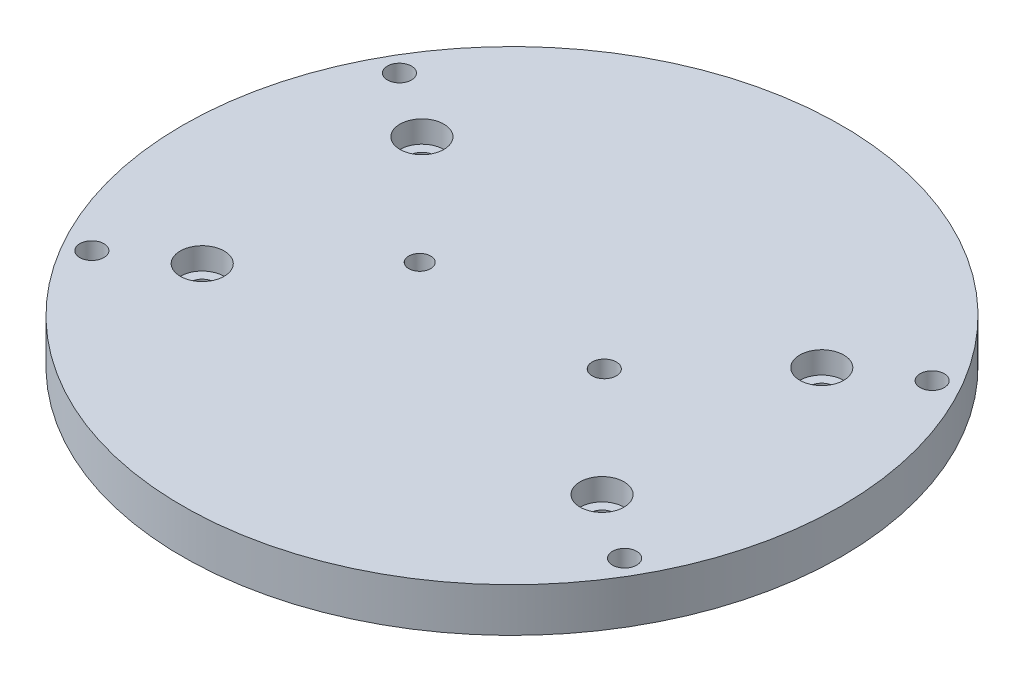
from build123d import *

# Parameters (mm, degrees)
SKETCH_1_R                   = 11
EXTRUDE_567_DEPTH            = 100
EXTRUDE_START                = -100
SKETCH_2_R                   = 11
EXTRUDE_876_DEPTH            = 100
EXTRUDE_2692_DEPTH           = 100
CUT_EXTRUDE_4149_DEPTH       = 534.010318849
CUT_EXTRUDE_4149_DEPTH_BACK  = 534.010318849
SKETCH_3_W                   = 90
SKETCH_3_H                   = 380
SKETCH_5_R                   = 2.5
EXTRUDE_4715_DEPTH           = 100
SKETCH_6_W                   = 191.177045066
SKETCH_6_H                   = 235.084722287
CUT_EXTRUDE_5029_DEPTH       = 84
SKETCH_7_R                   = 75
EXTRUDE_5317_DEPTH           = 10
CUT_EXTRUDE_6099_DEPTH       = 361.763080151
CUT_EXTRUDE_6099_DEPTH_BACK  = 361.763080151
FILLET_2_R                   = 2
MIRROR_START                 = 95
MIRROR_1_DEPTH               = 5
CUT_EXTRUDE_11152_DEPTH      = 361.763080151
CUT_EXTRUDE_11152_DEPTH_BACK = 361.763080151
SKETCH_12_W                  = 10
SKETCH_12_H                  = 20
FILLET_3_R                   = 1
CUT_EXTRUDE_START            = -5
CUT_EXTRUDE_12033_OUTLINE_R  = 5
CUT_EXTRUDE_12033_DEPTH      = 5
CUT_EXTRUDE_7_DEPTH          = 361.763080151
CUT_EXTRUDE_7_DEPTH_BACK     = 361.763080151
SKETCH_14_W                  = 10
SKETCH_14_H                  = 20
FILLET_4_R                   = 1
CUT_EXTRUDE_START_2          = -129
SKETCH_15_R                  = 11
CUT_EXTRUDE_8_DEPTH          = 129
SKETCH_16_R                  = 13
CUT_EXTRUDE_9_DEPTH          = 0.75
CUT_EXTRUDE_START_3          = -0.75
SKETCH_17_R                  = 13
CUT_EXTRUDE_10_DEPTH         = 0.75
SKETCH_18_R                  = 9.5
CUT_EXTRUDE_11_DEPTH         = 113
CUT_EXTRUDE_12_DEPTH         = 361.763080151
CUT_EXTRUDE_12_DEPTH_BACK    = 361.763080151
CUT_EXTRUDE_13_DEPTH         = 147.116391962
CUT_EXTRUDE_13_DEPTH_BACK    = 147.116391962
SKETCH_22_R                  = 2.75
SKETCH_22_R_2                = 2.5
SKETCH_26_R                  = 5
CUT_EXTRUDE_15_DEPTH         = 5


# Read off the part's stored shape, not the designer's step: 镜向1, 电机安装轴承孔
with BuildPart() as part:
    # 草图1 → Extrude 567 (new body)
    with BuildSketch(Plane.XY):
        with BuildLine():
            Line((-18, 500), (-18, 0))
            ThreePointArc((-18, 0), (0, -18), (18, 0))
            Line((18, 0), (18, 500))
            ThreePointArc((18, 500), (0, 518), (-18, 500))
        make_face()
        with Locations((0, 500)):
            Circle(SKETCH_1_R, mode=Mode.SUBTRACT)
        Circle(SKETCH_1_R, mode=Mode.SUBTRACT)
    extrude(amount=EXTRUDE_567_DEPTH)

    # 草图2 → Extrude 876 (add)
    with BuildSketch(Plane.XY.offset(100).offset(EXTRUDE_START)):
        with BuildLine():
            Line((18, 61.301270189), (25, 61.301270189))
            ThreePointArc((25, 61.301270189), (40.588457268, 52.301270189), (40.588457268, 34.301270189))
            Line((40.588457268, 34.301270189), (15.588457268, -9))
            ThreePointArc((15.588457268, -9), (-4.658742812, -17.386664873), (-18, 0))
            Line((-18, 0), (-18, 61.301270189))
            Line((-18, 61.301270189), (18, 61.301270189))
        make_face()
        with Locations((25, 43.301270189)):
            Circle(SKETCH_2_R, mode=Mode.SUBTRACT)
        Circle(SKETCH_2_R, mode=Mode.SUBTRACT)
    extrude(amount=EXTRUDE_876_DEPTH)

    # 草图10 → Extrude 2692 (add)
    with BuildSketch(Plane(origin=(0, 0, 0), x_dir=(-1, 0, 0), z_dir=(0, 0, -1))):
        with BuildLine():
            Line((-41.914467174, 37.144907609), (-58, 81.339545828))
            Line((-58, 81.339545828), (-58, 320))
            Line((-58, 320), (-18, 320))
            Line((-18, 320), (-18, 61.301270189))
            Line((-18, 61.301270189), (-25, 61.301270189))
            ThreePointArc((-25, 61.301270189), (-39.744736797, 53.625646044), (-41.914467174, 37.144907609))
        make_face()
        with BuildLine():
            Line((12.727922061, -12.727922061), (58, 32.544155877))
            Line((58, 32.544155877), (58, 320))
            Line((58, 320), (18, 320))
            Line((18, 320), (18, 0))
            ThreePointArc((18, 0), (16.629831585, -6.888301783), (12.727922061, -12.727922061))
        make_face()
    extrude(amount=-EXTRUDE_2692_DEPTH)

    # 草图3 → Cut-Extrude 4149 (cut, two sides: drawn at the far end of the back side and taken through both)
    with BuildSketch(Plane.ZY.offset(18).offset(-CUT_EXTRUDE_4149_DEPTH_BACK)):
        with Locations((50, 150)):
            Rectangle(SKETCH_3_W, SKETCH_3_H)
    extrude(amount=CUT_EXTRUDE_4149_DEPTH + CUT_EXTRUDE_4149_DEPTH_BACK, mode=Mode.SUBTRACT)

    # 草图5 → Extrude 4715 (add)
    with BuildSketch(Plane.XY.offset(100)):
        with Locations(Location((0, 250, 0), (0, 0, 90))):
            Circle(SKETCH_5_R)
    extrude(amount=-EXTRUDE_4715_DEPTH)

    # 草图6 → Cut-Extrude 5029 (cut)
    with BuildSketch(Plane(origin=(18, 0, 0), x_dir=(0, 0, -1), z_dir=(1, 0, 0))):
        with Locations((-50.962374235, 437.542361144)):
            Rectangle(SKETCH_6_W, SKETCH_6_H)
    extrude(amount=-CUT_EXTRUDE_5029_DEPTH, mode=Mode.SUBTRACT)

    # 草图7 → Extrude 5317 (add)
    with BuildSketch(Plane(origin=(0, 320, 0), x_dir=(1, 0, 0), z_dir=(0, 1, 0))):
        with Locations(Location((0, -50, 0), (0, 0, 320.654170234))):
            Circle(SKETCH_7_R)
    extrude(amount=EXTRUDE_5317_DEPTH)

    # 草图10<3> → Cut-Extrude 6099 (cut, two sides: drawn at the far end of the back side and taken through both)
    with BuildSketch(Plane(origin=(0, 0, 0), x_dir=(-1, 0, 0), z_dir=(0, 0, -1)).offset(-CUT_EXTRUDE_6099_DEPTH_BACK)):
        Polygon((50, 310), (18, 310), (18, 278), align=None)
        Polygon((-18, 278), (-18, 310), (-50, 310), align=None)
        Polygon((-18, 227.925713543), (-18, 259.925713543), (-50, 259.925713543), align=None)
        Polygon((50, 259.925713543), (18, 259.925713543), (18, 227.925713543), align=None)
        Polygon((50, 248.612005044), (50, 216.612005044), (18, 216.612005044), align=None)
        Polygon((-50, 248.612005044), (-50, 216.612005044), (-18, 216.612005044), align=None)
        Polygon((-18, 177.851427085), (-18, 209.851427085), (-50, 209.851427085), align=None)
        Polygon((50, 209.851427085), (18, 209.851427085), (18, 177.851427085), align=None)
        Polygon((50, 198.537718586), (50, 166.537718586), (18, 166.537718586), align=None)
        Polygon((-50, 198.537718586), (-50, 166.537718586), (-18, 166.537718586), align=None)
        Polygon((-50, 159.777140628), (-18, 127.777140628), (-18, 159.777140628), align=None)
        Polygon((18, 159.777140628), (18, 127.777140628), (50, 159.777140628), align=None)
        Polygon((-50, 109.702854171), (-18, 77.702854171), (-18, 109.702854171), align=None)
        Polygon((18, 109.702854171), (18, 77.702854171), (50, 109.702854171), align=None)
        Polygon((-50, 98.389145672), (-50, 82.750161674), (-44.045077173, 66.389145672), (-18, 66.389145672), align=None)
        Polygon((18, 56.800140588), (18, 24.800140588), (50, 56.800140588), align=None)
        Polygon((50, 95.560718547), (50, 63.560718547), (18, 63.560718547), align=None)
        Polygon((50, 116.463432129), (18, 116.463432129), (50, 148.463432129), align=None)
    extrude(amount=CUT_EXTRUDE_6099_DEPTH + CUT_EXTRUDE_6099_DEPTH_BACK, mode=Mode.SUBTRACT)

    # 圆角2
    fillet_2_edges = [part.edges().sort_by_distance(p)[0] for p in [
        (50, 109.702854171, 2.5),
        (18, 109.702854171, 2.5),
        (18, 77.702854171, 2.5),
        (-18, 159.777140628, 2.5),
        (-50, 159.777140628, 2.5),
        (-18, 127.777140628, 2.5),
        (50, 159.777140628, 2.5),
        (18, 159.777140628, 2.5),
        (18, 127.777140628, 2.5),
        (50, 166.537718586, 2.5),
        (50, 198.537718586, 2.5),
        (18, 166.537718586, 2.5),
        (-50, 63.560718547, 2.5),
        (-18, 63.560718547, 2.5),
        (-50, 95.560718547, 2.5),
        (-50, 56.800140588, 2.5),
        (-18, 24.800140588, 2.5),
        (-18, 56.800140588, 2.5),
        (50, 82.750161674, 2.5),
        (50, 98.389145672, 2.5),
        (18, 66.389145672, 2.5),
        (44.045077173, 66.389145672, 2.5),
        (-18, 109.702854171, 2.5),
        (-50, 109.702854171, 2.5),
        (-18, 77.702854171, 2.5),
        (50, 310, 2.5),
        (18, 310, 2.5),
        (18, 278, 2.5),
        (50, 259.925713543, 2.5),
        (18, 259.925713543, 2.5),
        (18, 227.925713543, 2.5),
        (-50, 248.612005044, 2.5),
        (-50, 216.612005044, 2.5),
        (-18, 216.612005044, 2.5),
        (-18, 259.925713543, 2.5),
        (-50, 259.925713543, 2.5),
        (-18, 227.925713543, 2.5),
        (50, 216.612005044, 2.5),
        (50, 248.612005044, 2.5),
        (18, 216.612005044, 2.5),
        (50, 209.851427085, 2.5),
        (18, 209.851427085, 2.5),
        (18, 177.851427085, 2.5),
        (-50, 198.537718586, 2.5),
        (-50, 166.537718586, 2.5),
        (-18, 166.537718586, 2.5),
        (-18, 209.851427085, 2.5),
        (-50, 209.851427085, 2.5),
        (-18, 177.851427085, 2.5),
        (-50, 148.463432129, 2.5),
        (-50, 116.463432129, 2.5),
        (-18, 116.463432129, 2.5),
        (-18, 310, 2.5),
        (-50, 310, 2.5),
        (-18, 278, 2.5),
    ]]
    fillet(fillet_2_edges, radius=FILLET_2_R)

    # 镜向1 outline → 镜向1 (add)
    with BuildSketch(Plane.XY.offset(MIRROR_START)):
        with BuildLine():
            ThreePointArc((-50, 143.635005004), (-48.765366865, 145.482764069), (-46.585786438, 145.049218567))
            Line((-46.585786438, 145.049218567), (-50, 148.463432129))
            Line((-50, 148.463432129), (-50, 143.635005004))
        make_face()
        with BuildLine():
            Line((-18, 116.463432129), (-21.414213562, 119.877645691))
            ThreePointArc((-21.414213562, 119.877645691), (-20.98066806, 117.698065264), (-22.828427125, 116.463432129))
            Line((-22.828427125, 116.463432129), (-18, 116.463432129))
        make_face()
        with BuildLine():
            ThreePointArc((-48, 116.463432129), (-49.414213562, 117.049218567), (-50, 118.463432129))
            Line((-50, 118.463432129), (-50, 116.463432129))
            Line((-50, 116.463432129), (-48, 116.463432129))
        make_face()
        with BuildLine():
            ThreePointArc((-20, 310), (-18.585786438, 309.414213562), (-18, 308))
            Line((-18, 308), (-18, 310))
            Line((-18, 310), (-20, 310))
        make_face()
        with BuildLine():
            Line((-18, 278), (-18, 282.828427125))
            ThreePointArc((-18, 282.828427125), (-19.234633135, 280.98066806), (-21.414213562, 281.414213562))
            Line((-21.414213562, 281.414213562), (-18, 278))
        make_face()
        with BuildLine():
            ThreePointArc((-46.585786438, 306.585786438), (-47.01933194, 308.765366865), (-45.171572875, 310))
            Line((-45.171572875, 310), (-50, 310))
            Line((-50, 310), (-46.585786438, 306.585786438))
        make_face()
        with BuildLine():
            ThreePointArc((-20, 259.925713543), (-18.585786438, 259.339927105), (-18, 257.925713543))
            Line((-18, 257.925713543), (-18, 259.925713543))
            Line((-18, 259.925713543), (-20, 259.925713543))
        make_face()
        with BuildLine():
            Line((-18, 227.925713543), (-18, 232.754140667))
            ThreePointArc((-18, 232.754140667), (-19.234633135, 230.906381602), (-21.414213562, 231.339927105))
            Line((-21.414213562, 231.339927105), (-18, 227.925713543))
        make_face()
        with BuildLine():
            ThreePointArc((-46.585786438, 256.51149998), (-47.01933194, 258.691080407), (-45.171572875, 259.925713543))
            Line((-45.171572875, 259.925713543), (-50, 259.925713543))
            Line((-50, 259.925713543), (-46.585786438, 256.51149998))
        make_face()
        with BuildLine():
            ThreePointArc((-50, 243.783577919), (-48.765366865, 245.631336984), (-46.585786438, 245.197791481))
            Line((-46.585786438, 245.197791481), (-50, 248.612005044))
            Line((-50, 248.612005044), (-50, 243.783577919))
        make_face()
        with BuildLine():
            Line((-18, 216.612005044), (-21.414213562, 220.026218606))
            ThreePointArc((-21.414213562, 220.026218606), (-20.98066806, 217.846638179), (-22.828427125, 216.612005044))
            Line((-22.828427125, 216.612005044), (-18, 216.612005044))
        make_face()
        with BuildLine():
            ThreePointArc((-48, 216.612005044), (-49.414213563, 217.197791481), (-50, 218.612005044))
            Line((-50, 218.612005044), (-50, 216.612005044))
            Line((-50, 216.612005044), (-48, 216.612005044))
        make_face()
        with BuildLine():
            ThreePointArc((-20, 209.851427085), (-18.585786438, 209.265640647), (-18, 207.851427085))
            Line((-18, 207.851427085), (-18, 209.851427085))
            Line((-18, 209.851427085), (-20, 209.851427085))
        make_face()
        with BuildLine():
            Line((-18, 177.851427085), (-18, 182.67985421))
            ThreePointArc((-18, 182.67985421), (-19.234633135, 180.832095145), (-21.414213562, 181.265640648))
            Line((-21.414213562, 181.265640648), (-18, 177.851427085))
        make_face()
        with BuildLine():
            ThreePointArc((-46.585786438, 206.437213523), (-47.01933194, 208.61679395), (-45.171572875, 209.851427085))
            Line((-45.171572875, 209.851427085), (-50, 209.851427085))
            Line((-50, 209.851427085), (-46.585786438, 206.437213523))
        make_face()
        with BuildLine():
            ThreePointArc((-50, 193.709291462), (-48.765366865, 195.557050527), (-46.585786438, 195.123505024))
            Line((-46.585786438, 195.123505024), (-50, 198.537718586))
            Line((-50, 198.537718586), (-50, 193.709291462))
        make_face()
        with BuildLine():
            Line((-18, 166.537718586), (-21.414213562, 169.951932149))
            ThreePointArc((-21.414213562, 169.951932149), (-20.98066806, 167.772351722), (-22.828427125, 166.537718586))
            Line((-22.828427125, 166.537718586), (-18, 166.537718586))
        make_face()
        with BuildLine():
            ThreePointArc((-48, 166.537718586), (-49.414213562, 167.123505024), (-50, 168.537718586))
            Line((-50, 168.537718586), (-50, 166.537718586))
            Line((-50, 166.537718586), (-48, 166.537718586))
        make_face()
        with BuildLine():
            ThreePointArc((-20, 159.777140628), (-18.585786438, 159.19135419), (-18, 157.777140628))
            Line((-18, 157.777140628), (-18, 159.777140628))
            Line((-18, 159.777140628), (-20, 159.777140628))
        make_face()
        with BuildLine():
            Line((-18, 127.777140628), (-18, 132.605567753))
            ThreePointArc((-18, 132.605567753), (-19.234633135, 130.757808688), (-21.414213562, 131.19135419))
            Line((-21.414213562, 131.19135419), (-18, 127.777140628))
        make_face()
        with BuildLine():
            ThreePointArc((-46.585786438, 156.362927066), (-47.01933194, 158.542507493), (-45.171572875, 159.777140628))
            Line((-45.171572875, 159.777140628), (-50, 159.777140628))
            Line((-50, 159.777140628), (-46.585786438, 156.362927066))
        make_face()
        with BuildLine():
            ThreePointArc((-20, 109.702854171), (-18.585786438, 109.117067733), (-18, 107.702854171))
            Line((-18, 107.702854171), (-18, 109.702854171))
            Line((-18, 109.702854171), (-20, 109.702854171))
        make_face()
        with BuildLine():
            Line((-18, 77.702854171), (-18, 82.531281295))
            ThreePointArc((-18, 82.531281295), (-19.234633135, 80.68352223), (-21.414213562, 81.117067733))
            Line((-21.414213562, 81.117067733), (-18, 77.702854171))
        make_face()
        with BuildLine():
            ThreePointArc((-46.585786438, 106.288640608), (-47.01933194, 108.468221035), (-45.171572875, 109.702854171))
            Line((-45.171572875, 109.702854171), (-50, 109.702854171))
            Line((-50, 109.702854171), (-46.585786438, 106.288640608))
        make_face()
        with BuildLine():
            ThreePointArc((-50, 90.732291422), (-48.765366865, 92.580050487), (-46.585786438, 92.146504984))
            Line((-46.585786438, 92.146504984), (-50, 95.560718547))
            Line((-50, 95.560718547), (-50, 90.732291422))
        make_face()
        with BuildLine():
            Line((-18, 63.560718547), (-21.414213562, 66.974932109))
            ThreePointArc((-21.414213562, 66.974932109), (-20.98066806, 64.795351682), (-22.828427125, 63.560718547))
            Line((-22.828427125, 63.560718547), (-18, 63.560718547))
        make_face()
        with BuildLine():
            ThreePointArc((-48, 63.560718547), (-49.414213562, 64.146504984), (-50, 65.560718547))
            Line((-50, 65.560718547), (-50, 63.560718547))
            Line((-50, 63.560718547), (-48, 63.560718547))
        make_face()
        with BuildLine():
            ThreePointArc((-46.585786438, 53.385927026), (-47.01933194, 55.565507453), (-45.171572875, 56.800140588))
            Line((-45.171572875, 56.800140588), (-50, 56.800140588))
            Line((-50, 56.800140588), (-46.585786438, 53.385927026))
        make_face()
        with BuildLine():
            Line((-18, 56.800140588), (-20, 56.800140588))
            ThreePointArc((-20, 56.800140588), (-18.585786437, 56.214354151), (-18, 54.800140588))
            Line((-18, 54.800140588), (-18, 56.800140588))
        make_face()
        with BuildLine():
            ThreePointArc((-18, 29.628567713), (-19.234633135, 27.780808648), (-21.414213562, 28.214354151))
            Line((-21.414213562, 28.214354151), (-18, 24.800140588))
            Line((-18, 24.800140588), (-18, 29.628567713))
        make_face()
        with BuildLine():
            ThreePointArc((46.585786438, 94.974932109), (48.765366865, 95.408477612), (50, 93.560718547))
            Line((50, 93.560718547), (50, 98.389145672))
            Line((50, 98.389145672), (46.585786438, 94.974932109))
        make_face()
        with BuildLine():
            Line((50, 82.750161674), (50, 83.102815635))
            ThreePointArc((50, 83.102815635), (49.969615506, 82.75551928), (49.879385242, 82.418775349))
            Line((49.879385242, 82.418775349), (50, 82.750161674))
        make_face()
        with BuildLine():
            ThreePointArc((22.828427125, 66.389145672), (20.98066806, 67.623778807), (21.414213562, 69.803359234))
            Line((21.414213562, 69.803359234), (18, 66.389145672))
            Line((18, 66.389145672), (22.828427125, 66.389145672))
        make_face()
        with BuildLine():
            Line((44.045077173, 66.389145672), (44.524047338, 67.705105385))
            ThreePointArc((44.524047338, 67.705105385), (43.791814969, 66.750841583), (42.644662096, 66.389145672))
            Line((42.644662096, 66.389145672), (44.045077173, 66.389145672))
        make_face()
        with BuildLine():
            Line((18, 109.702854171), (18, 107.702854171))
            ThreePointArc((18, 107.702854171), (18.585786438, 109.117067733), (20, 109.702854171))
            Line((20, 109.702854171), (18, 109.702854171))
        make_face()
        with BuildLine():
            ThreePointArc((21.414213562, 81.117067733), (19.234633135, 80.68352223), (18, 82.531281295))
            Line((18, 82.531281295), (18, 77.702854171))
            Line((18, 77.702854171), (21.414213562, 81.117067733))
        make_face()
        with BuildLine():
            Line((50, 109.702854171), (45.171572875, 109.702854171))
            ThreePointArc((45.171572875, 109.702854171), (47.01933194, 108.468221035), (46.585786438, 106.288640608))
            Line((46.585786438, 106.288640608), (50, 109.702854171))
        make_face()
        with BuildLine():
            Line((18, 159.777140628), (18, 157.777140628))
            ThreePointArc((18, 157.777140628), (18.585786438, 159.19135419), (20, 159.777140628))
            Line((20, 159.777140628), (18, 159.777140628))
        make_face()
        with BuildLine():
            ThreePointArc((21.414213562, 131.19135419), (19.234633135, 130.757808688), (18, 132.605567753))
            Line((18, 132.605567753), (18, 127.777140628))
            Line((18, 127.777140628), (21.414213562, 131.19135419))
        make_face()
        with BuildLine():
            Line((50, 159.777140628), (45.171572875, 159.777140628))
            ThreePointArc((45.171572875, 159.777140628), (47.01933194, 158.542507493), (46.585786438, 156.362927066))
            Line((46.585786438, 156.362927066), (50, 159.777140628))
        make_face()
        with BuildLine():
            ThreePointArc((50, 168.537718586), (49.414213562, 167.123505024), (48, 166.537718586))
            Line((48, 166.537718586), (50, 166.537718586))
            Line((50, 166.537718586), (50, 168.537718586))
        make_face()
        with BuildLine():
            Line((18, 166.537718586), (22.828427125, 166.537718586))
            ThreePointArc((22.828427125, 166.537718586), (20.98066806, 167.772351722), (21.414213562, 169.951932149))
            Line((21.414213562, 169.951932149), (18, 166.537718586))
        make_face()
        with BuildLine():
            ThreePointArc((46.585786438, 195.123505024), (48.765366865, 195.557050527), (50, 193.709291462))
            Line((50, 193.709291462), (50, 198.537718586))
            Line((50, 198.537718586), (46.585786438, 195.123505024))
        make_face()
        with BuildLine():
            Line((18, 177.851427085), (21.414213562, 181.265640648))
            ThreePointArc((21.414213562, 181.265640648), (19.234633135, 180.832095145), (18, 182.67985421))
            Line((18, 182.67985421), (18, 177.851427085))
        make_face()
        with BuildLine():
            ThreePointArc((45.171572875, 209.851427085), (47.01933194, 208.61679395), (46.585786438, 206.437213523))
            Line((46.585786438, 206.437213523), (50, 209.851427085))
            Line((50, 209.851427085), (45.171572875, 209.851427085))
        make_face()
        with BuildLine():
            Line((18, 209.851427085), (18, 207.851427085))
            ThreePointArc((18, 207.851427085), (18.585786438, 209.265640647), (20, 209.851427085))
            Line((20, 209.851427085), (18, 209.851427085))
        make_face()
        with BuildLine():
            ThreePointArc((50, 218.612005044), (49.414213563, 217.197791481), (48, 216.612005044))
            Line((48, 216.612005044), (50, 216.612005044))
            Line((50, 216.612005044), (50, 218.612005044))
        make_face()
        with BuildLine():
            Line((18, 216.612005044), (22.828427125, 216.612005044))
            ThreePointArc((22.828427125, 216.612005044), (20.98066806, 217.846638179), (21.414213562, 220.026218606))
            Line((21.414213562, 220.026218606), (18, 216.612005044))
        make_face()
        with BuildLine():
            ThreePointArc((46.585786438, 245.197791481), (48.765366865, 245.631336984), (50, 243.783577919))
            Line((50, 243.783577919), (50, 248.612005044))
            Line((50, 248.612005044), (46.585786438, 245.197791481))
        make_face()
        with BuildLine():
            Line((18, 227.925713543), (21.414213562, 231.339927105))
            ThreePointArc((21.414213562, 231.339927105), (19.234633135, 230.906381602), (18, 232.754140667))
            Line((18, 232.754140667), (18, 227.925713543))
        make_face()
        with BuildLine():
            ThreePointArc((45.171572875, 259.925713543), (47.01933194, 258.691080407), (46.585786438, 256.51149998))
            Line((46.585786438, 256.51149998), (50, 259.925713543))
            Line((50, 259.925713543), (45.171572875, 259.925713543))
        make_face()
        with BuildLine():
            Line((18, 259.925713543), (18, 257.925713543))
            ThreePointArc((18, 257.925713543), (18.585786438, 259.339927105), (20, 259.925713543))
            Line((20, 259.925713543), (18, 259.925713543))
        make_face()
        with BuildLine():
            Line((18, 278), (21.414213562, 281.414213562))
            ThreePointArc((21.414213562, 281.414213562), (19.234633135, 280.98066806), (18, 282.828427125))
            Line((18, 282.828427125), (18, 278))
        make_face()
        with BuildLine():
            ThreePointArc((45.171572875, 310), (47.01933194, 308.765366865), (46.585786438, 306.585786438))
            Line((46.585786438, 306.585786438), (50, 310))
            Line((50, 310), (45.171572875, 310))
        make_face()
        with BuildLine():
            Line((18, 310), (18, 308))
            ThreePointArc((18, 308), (18.585786438, 309.414213562), (20, 310))
            Line((20, 310), (18, 310))
        make_face()
    extrude(amount=MIRROR_1_DEPTH)

    # 草图12 → Cut-Extrude 11152 (cut, two sides: drawn at the far end of the back side and taken through both)
    with BuildSketch(Plane(origin=(0, 0, 0), x_dir=(-1, 0, 0), z_dir=(0, 0, -1)).offset(-CUT_EXTRUDE_11152_DEPTH_BACK)):
        with Locations((-53, 285)):
            Rectangle(SKETCH_12_W, SKETCH_12_H)
        with Locations((-53, 134.702854171)):
            Rectangle(SKETCH_12_W, SKETCH_12_H)
        with Locations((53, 285)):
            Rectangle(SKETCH_12_W, SKETCH_12_H)
    extrude(amount=CUT_EXTRUDE_11152_DEPTH + CUT_EXTRUDE_11152_DEPTH_BACK, mode=Mode.SUBTRACT)

    # 圆角3
    fillet_3_edges = [part.edges().sort_by_distance(p)[0] for p in [
        (-48, 275, 2.5),
        (-48, 295, 2.5),
        (-48, 275, 97.5),
        (-48, 295, 97.5),
        (48, 144.702854171, 2.5),
        (48, 124.702854171, 2.5),
        (48, 144.702854171, 97.5),
        (48, 124.702854171, 97.5),
        (48, 295, 2.5),
        (48, 275, 2.5),
        (48, 295, 97.5),
        (48, 275, 97.5),
    ]]
    fillet(fillet_3_edges, radius=FILLET_3_R)

    # Cut-Extrude 12033 outline → Cut-Extrude 12033 (cut)
    with BuildSketch(Plane.XY.offset(5).offset(CUT_EXTRUDE_START)):
        with Locations((0, 250)):
            Circle(CUT_EXTRUDE_12033_OUTLINE_R)
    cut_extrude_12033 = extrude(amount=CUT_EXTRUDE_12033_DEPTH, mode=Mode.SUBTRACT)

    # 镜向2: Cut-Extrude 12033 across plane
    add(cut_extrude_12033.mirror(Plane(origin=(0, 0, 50), x_dir=(1, 0, 0), z_dir=(0, 0, -1))), mode=Mode.SUBTRACT)

    # 草图14 → 切除-拉伸7 (cut, two sides: drawn at the far end of the back side and taken through both)
    with BuildSketch(Plane(origin=(0, 0, 0), x_dir=(-1, 0, 0), z_dir=(0, 0, -1)).offset(-CUT_EXTRUDE_7_DEPTH_BACK)):
        with Locations((0, 110)):
            Rectangle(SKETCH_14_W, SKETCH_14_H)
    extrude(amount=CUT_EXTRUDE_7_DEPTH + CUT_EXTRUDE_7_DEPTH_BACK, mode=Mode.SUBTRACT)

    # 圆角4
    fillet_4_edges = [part.edges().sort_by_distance(p)[0] for p in [
        (5, 100, 2.5),
        (5, 120, 2.5),
        (-5, 120, 2.5),
        (-5, 100, 2.5),
        (5, 100, 97.5),
        (5, 120, 97.5),
        (-5, 120, 97.5),
        (-5, 100, 97.5),
    ]]
    fillet(fillet_4_edges, radius=FILLET_4_R)

    # 草图15 → 切除-拉伸8 (cut)
    with BuildSketch(Plane.XY.offset(100).offset(CUT_EXTRUDE_START_2)):
        with Locations((25, 43.301270189)):
            Circle(SKETCH_15_R)
    extrude(amount=CUT_EXTRUDE_8_DEPTH, mode=Mode.SUBTRACT)

    # 草图16 → 切除-拉伸9 (cut)
    with BuildSketch(Plane.XY.offset(100)):
        with Locations((25, 43.301270189)):
            Circle(SKETCH_16_R)
        Circle(SKETCH_16_R)
    extrude(amount=-CUT_EXTRUDE_9_DEPTH, mode=Mode.SUBTRACT)

    # 草图17 → 切除-拉伸10 (cut)
    with BuildSketch(Plane(origin=(0, 0, 0), x_dir=(-1, 0, 0), z_dir=(0, 0, -1)).offset(CUT_EXTRUDE_START_3)):
        with Locations(Location((0, 0, 0), (0, 0, 180))):
            Circle(SKETCH_17_R)
        with Locations(Location((-25, 43.301270189, 0), (0, 0, 180))):
            Circle(SKETCH_17_R)
    extrude(amount=CUT_EXTRUDE_10_DEPTH, mode=Mode.SUBTRACT)

    # 草图18 → 切除-拉伸11 (cut)
    with BuildSketch(Plane.XY.offset(100)):
        with Locations((0, 250)):
            Circle(SKETCH_18_R)
    extrude(amount=-CUT_EXTRUDE_11_DEPTH, mode=Mode.SUBTRACT)

    # 草图19 → 旋转1 (revolve)
    with BuildSketch(Plane(origin=(0, 0, 0), x_dir=(0, 0, -1), z_dir=(1, 0, 0)), mode=Mode.PRIVATE) as revolve_1_sk:
        Polygon((0, 239.5), (2, 239.5), (2, 241.5), (1, 241.5), (1, 240.5), (0, 240.5), align=None)
        Polygon((-100, 239.5), (-102, 239.5), (-102, 241.5), (-101, 241.5), (-101, 240.5), (-100, 240.5), align=None)
    revolve(revolve_1_sk.sketch.rotate(Axis((0, 250, 0), (0, 0, 1)), 270), axis=Axis((0, 250, 0), (0, 0, 1)))

    # 草图20 → 切除-拉伸12 (cut, two sides: drawn at the far end of the back side and taken through both)
    with BuildSketch(Plane(origin=(0, 0, 0), x_dir=(0, 0, -1), z_dir=(1, 0, 0)).offset(-CUT_EXTRUDE_12_DEPTH_BACK)):
        Polygon((-125, 320), (-100, 320), (86.391233393, 320), (86.391233393, -40.749673817), (-162.32877764, -40.749673817), (-162.32877764, 320), align=None)
    extrude(amount=CUT_EXTRUDE_12_DEPTH + CUT_EXTRUDE_12_DEPTH_BACK, mode=Mode.SUBTRACT)

    # 草图22 → 切除-拉伸13 (cut, two sides: drawn at the far end of the back side and taken through both)
    with BuildSketch(Plane.XZ.offset(-320).offset(-CUT_EXTRUDE_13_DEPTH_BACK)):
        with Locations((21, 50)):
            Circle(SKETCH_22_R)
        with Locations((-21, 50)):
            Circle(SKETCH_22_R_2)
        with Locations((45.5, 75)):
            Circle(SKETCH_22_R)
        with Locations((45.5, 25)):
            Circle(SKETCH_22_R)
        with Locations(Location((-45.5, 25, 0), (0, 0, 180))):
            Circle(SKETCH_22_R)
        with Locations(Location((-45.5, 75, 0), (0, 0, 180))):
            Circle(SKETCH_22_R)
        with Locations((60.621778265, 85)):
            Circle(SKETCH_22_R)
        with Locations(Location((60.621778265, 15, 0), (0, 0, 180))):
            Circle(SKETCH_22_R)
        with Locations((-60.621778265, 15)):
            Circle(SKETCH_22_R)
        with Locations(Location((-60.621778265, 85, 0), (0, 0, 180))):
            Circle(SKETCH_22_R)
    extrude(amount=CUT_EXTRUDE_13_DEPTH + CUT_EXTRUDE_13_DEPTH_BACK, mode=Mode.SUBTRACT)

    # 草图26 → 切除-拉伸15 (cut)
    with BuildSketch(Plane(origin=(0, 330, 0), x_dir=(1, 0, 0), z_dir=(0, 1, 0))):
        with Locations(Location((45.5, -25, 0), (0, 0, 180))):
            Circle(SKETCH_26_R)
        with Locations(Location((45.5, -75, 0), (0, 0, 180))):
            Circle(SKETCH_26_R)
        with Locations(Location((-45.5, -75, 0), (0, 0, 180))):
            Circle(SKETCH_26_R)
        with Locations(Location((-45.5, -25, 0), (0, 0, 180))):
            Circle(SKETCH_26_R)
    extrude(amount=-CUT_EXTRUDE_15_DEPTH, mode=Mode.SUBTRACT)


solid = part.part
